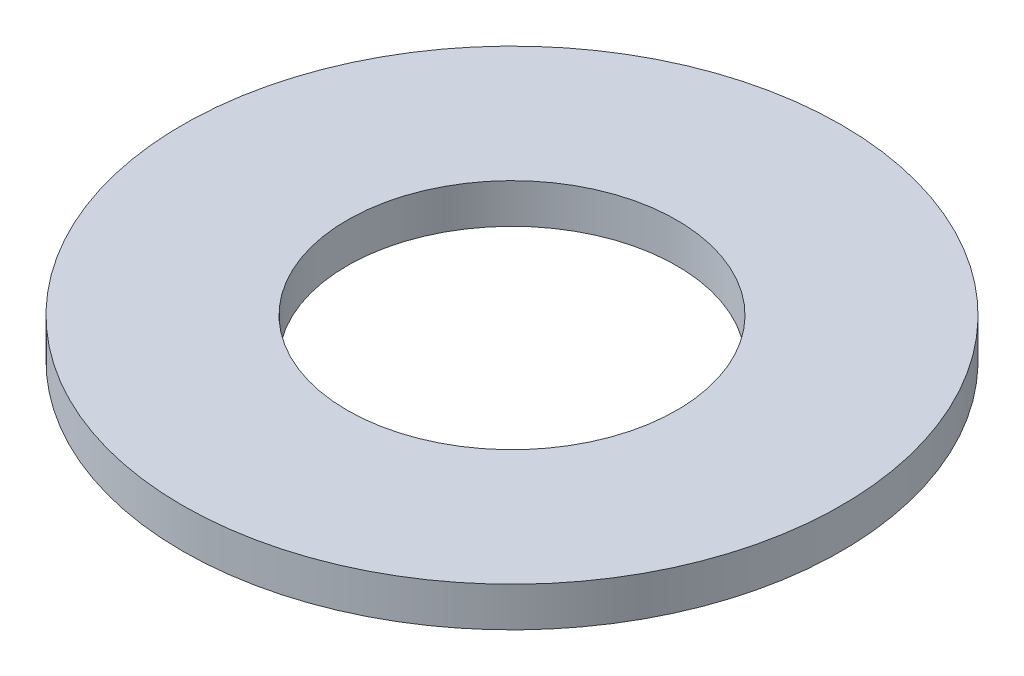
from build123d import *

# Parameters (mm, degrees)
SKETCH1_R           = 75
BOSS_EXTRUDE1_DEPTH = 9
SKETCH2_R           = 37.5
CUT_EXTRUDE1_DEPTH  = 107.447169995


with BuildPart() as part:
    # Sketch1 → Boss-Extrude1 (new body)
    with BuildSketch(Plane(origin=(0, 0, 0), x_dir=(1, 0, 0), z_dir=(0, 1, 0))):
        Circle(SKETCH1_R)
    extrude(amount=BOSS_EXTRUDE1_DEPTH)

    # Sketch2 → Cut-Extrude1 (cut, through all)
    with BuildSketch(Plane(origin=(0, 0, 0), x_dir=(1, 0, 0), z_dir=(0, 1, 0))):
        Circle(SKETCH2_R)
    extrude(amount=CUT_EXTRUDE1_DEPTH, mode=Mode.SUBTRACT)


solid = part.part
